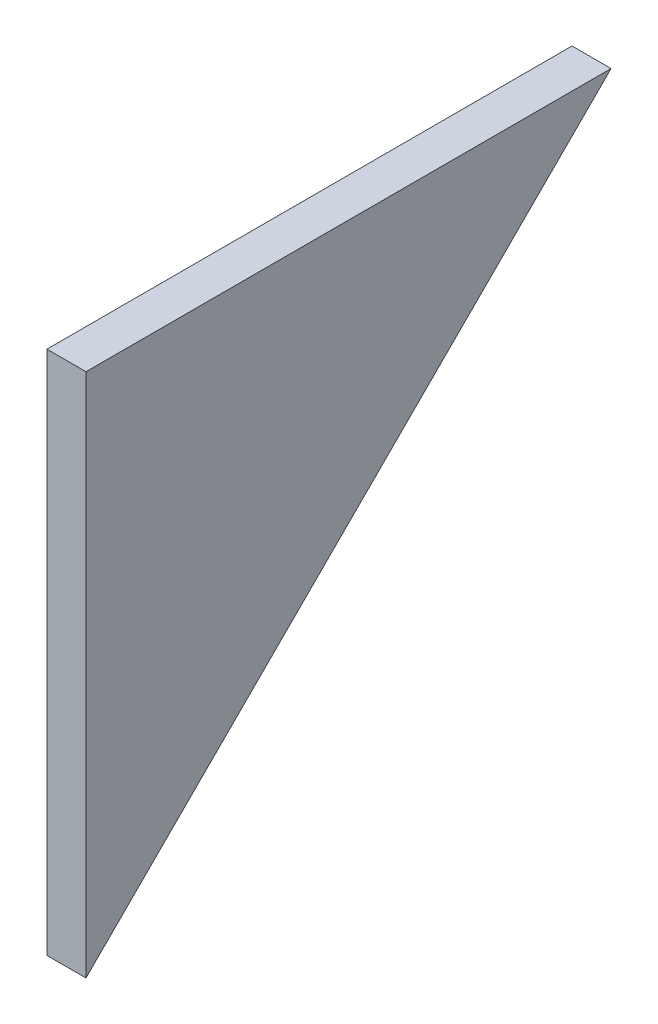
from build123d import *

# Parameters (mm, degrees)
EXTRUDE_1_DEPTH = 2


with BuildPart() as part:
    # Sketch 1 → Бобышка-Вытянуть1 (new, symmetric)
    with BuildSketch(Plane(origin=(0, 0, 0), x_dir=(0, 0, -1), z_dir=(1, 0, 0))):
        Polygon((53.77381068, 0), (0, 0), (0, -53.77381068), align=None)
    extrude(amount=EXTRUDE_1_DEPTH, both=True)


solid = part.part
